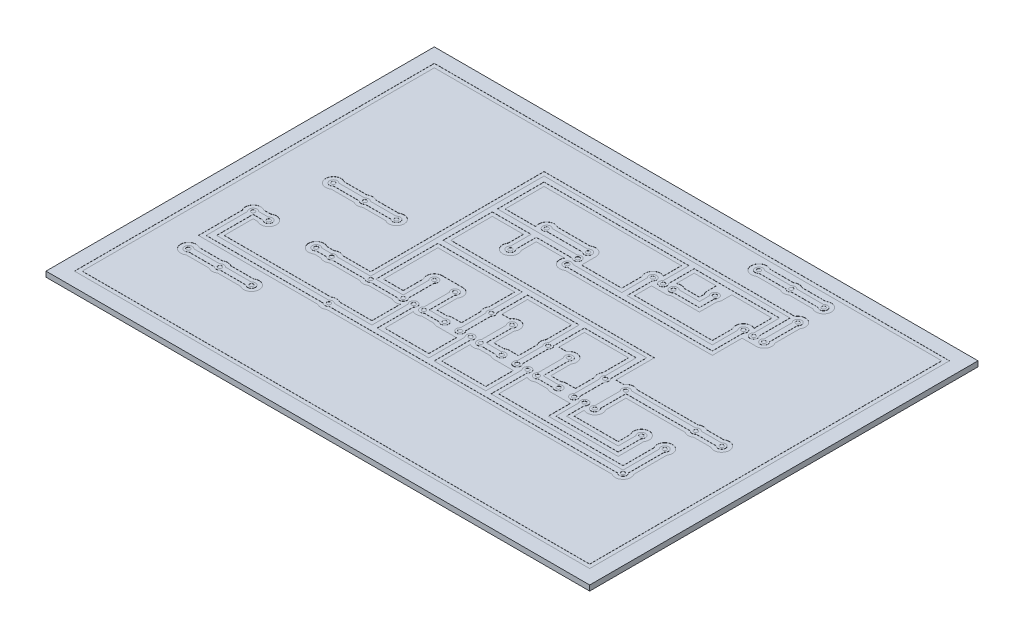
from build123d import *

# Parameters (mm, degrees)
SKETCH1_W           = 210
SKETCH1_H           = 150
BOSS_EXTRUDE3_DEPTH = 2
SKETCH1_5_R         = 0.75
SKETCH1_5_R_2       = 0.750000002
SKETCH1_5_R_3       = 0.750000001
BOSS_EXTRUDE4_DEPTH = 2.05
SKETCH2_W           = 210
SKETCH2_H           = 150
BOSS_EXTRUDE6_DEPTH = 0.05
SKETCH3_W           = 199
SKETCH3_H           = 139
SKETCH3_W_2         = 196
SKETCH3_H_2         = 136
CUT_EXTRUDE1_DEPTH  = 0.05


with BuildPart() as part:
    # Sketch1 → Boss-Extrude3 (new body)
    with BuildSketch(Plane(origin=(0, 0, 0), x_dir=(1, 0, 0), z_dir=(0, 1, 0))):
        Rectangle(SKETCH1_W, SKETCH1_H)
    extrude(amount=BOSS_EXTRUDE3_DEPTH)

    # Sketch1<5> → Boss-Extrude4 (add)
    # profile 1 of 14: a face of its own
    with BuildSketch(Plane(origin=(0, 0, 0), x_dir=(1, 0, 0), z_dir=(0, 1, 0))):
        with BuildLine():
            ThreePointArc((-83.881966011, -14), (-86.060660172, -13.939339828), (-86, -16.118033989))
            Line((-86, -16.118033989), (-86, -32.118033989))
            Line((-86, -32.118033989), (-40.736067977, -32.118033989))
            ThreePointArc((-40.736067977, -32.118033989), (-39.618033989, -32.618033989), (-38.5, -32.118033989))
            Line((-38.5, -32.118033989), (72.881966011, -32.118033989))
            ThreePointArc((72.881966011, -32.118033989), (75.060660172, -32.178694161), (75, -30))
            Line((75, -30), (75, -16.118033989))
            ThreePointArc((75, -16.118033989), (74, -13.5), (73, -16.118033989))
            Line((73, -16.118033989), (73, -30))
            ThreePointArc((73, -30), (72.939339828, -30.057373817), (72.881966011, -30.118033989))
            Line((72.881966011, -30.118033989), (22, -30.118033989))
            Line((22, -30.118033989), (22, -16.118033989))
            ThreePointArc((22, -16.118033989), (21, -13.5), (20, -16.118033989))
            Line((20, -16.118033989), (20, -30.118033989))
            Line((20, -30.118033989), (0, -30.118033989))
            Line((0, -30.118033989), (0, -16.118033989))
            ThreePointArc((0, -16.118033989), (-1, -13.5), (-2, -16.118033989))
            Line((-2, -16.118033989), (-2, -30.118033989))
            Line((-2, -30.118033989), (-22, -30.118033989))
            Line((-22, -30.118033989), (-22, -16.118033989))
            ThreePointArc((-22, -16.118033989), (-23, -13.5), (-24, -16.118033989))
            Line((-24, -16.118033989), (-24, -30.118033989))
            Line((-24, -30.118033989), (-38.5, -30.118033989))
            ThreePointArc((-38.5, -30.118033989), (-39.618033989, -29.618033989), (-40.736067977, -30.118033989))
            Line((-40.736067977, -30.118033989), (-84, -30.118033989))
            Line((-84, -30.118033989), (-84, -16.118033989))
            ThreePointArc((-84, -16.118033989), (-83.939339828, -16.060660172), (-83.881966011, -16))
            Line((-83.881966011, -16), (-80.118033989, -16))
            ThreePointArc((-80.118033989, -16), (-77.5, -15), (-80.118033989, -14))
            Line((-80.118033989, -14), (-83.881966011, -14))
        make_face()
        with Locations((-85, -15)):
            Circle(SKETCH1_5_R, mode=Mode.SUBTRACT)
        with Locations((-79, -15)):
            Circle(SKETCH1_5_R, mode=Mode.SUBTRACT)
        with Locations((-39.618033989, -31.118033989)):
            Circle(SKETCH1_5_R, mode=Mode.SUBTRACT)
        with Locations((-23, -15)):
            Circle(SKETCH1_5_R_2, mode=Mode.SUBTRACT)
        with Locations((-1, -15)):
            Circle(SKETCH1_5_R_3, mode=Mode.SUBTRACT)
        with Locations((21, -15)):
            Circle(SKETCH1_5_R_3, mode=Mode.SUBTRACT)
        with Locations((74, -31.118033989)):
            Circle(SKETCH1_5_R, mode=Mode.SUBTRACT)
        with Locations((74, -15)):
            Circle(SKETCH1_5_R, mode=Mode.SUBTRACT)
    # profile 2 of 14: a face of its own
    with BuildSketch(Plane(origin=(0, 0, 0), x_dir=(1, 0, 0), z_dir=(0, 1, 0))):
        with BuildLine():
            Line((-20, -4.118033989), (-20, -13.881966011))
            ThreePointArc((-20, -13.881966011), (-20.060660172, -16.060660172), (-17.881966011, -16))
            Line((-17.881966011, -16), (-12.118033989, -16))
            ThreePointArc((-12.118033989, -16), (-9.5, -15), (-12.118033989, -14))
            Line((-12.118033989, -14), (-17.881966011, -14))
            ThreePointArc((-17.881966011, -14), (-17.939339828, -13.939339828), (-18, -13.881966011))
            Line((-18, -13.881966011), (-18, -4.118033989))
            ThreePointArc((-18, -4.118033989), (-19, -1.5), (-20, -4.118033989))
        make_face()
        with Locations((-19, -15)):
            Circle(SKETCH1_5_R_2, mode=Mode.SUBTRACT)
        with Locations((-11, -15)):
            Circle(SKETCH1_5_R, mode=Mode.SUBTRACT)
        with Locations((-19, -3)):
            Circle(SKETCH1_5_R, mode=Mode.SUBTRACT)
    # profile 3 of 14: a face of its own
    with BuildSketch(Plane(origin=(0, 0, 0), x_dir=(1, 0, 0), z_dir=(0, 1, 0))):
        with BuildLine():
            Line((-26, -13.881966011), (-26, -4.118033989))
            ThreePointArc((-26, -4.118033989), (-27, -1.5), (-28, -4.118033989))
            Line((-28, -4.118033989), (-28, -13.881966011))
            ThreePointArc((-28, -13.881966011), (-28.060660172, -13.939339828), (-28.118033989, -14))
            Line((-28.118033989, -14), (-38.5, -14))
            ThreePointArc((-38.5, -14), (-38.557373817, -13.939339828), (-38.618033989, -13.881966011))
            Line((-38.618033989, -13.881966011), (-38.618033989, 10))
            Line((-38.618033989, 10), (-6, 10))
            Line((-6, 10), (-6, -1.881966011))
            ThreePointArc((-6, -1.881966011), (-6.5, -3), (-6, -4.118033989))
            Line((-6, -4.118033989), (-6, -13.881966011))
            ThreePointArc((-6, -13.881966011), (-5, -16.5), (-4, -13.881966011))
            Line((-4, -13.881966011), (-4, -4.118033989))
            ThreePointArc((-4, -4.118033989), (-3.5, -3), (-4, -1.881966011))
            Line((-4, -1.881966011), (-4, 10))
            Line((-4, 10), (16, 10))
            Line((16, 10), (16, -1.881966011))
            ThreePointArc((16, -1.881966011), (15.5, -3), (16, -4.118033989))
            Line((16, -4.118033989), (16, -13.881966011))
            ThreePointArc((16, -13.881966011), (17, -16.5), (18, -13.881966011))
            Line((18, -13.881966011), (18, -4.118033989))
            ThreePointArc((18, -4.118033989), (18.5, -3), (18, -1.881966011))
            Line((18, -1.881966011), (18, 10))
            Line((18, 10), (38, 10))
            Line((38, 10), (38, -1.881966011))
            ThreePointArc((38, -1.881966011), (37.5, -3), (38, -4.118033989))
            Line((38, -4.118033989), (38, -13.881966011))
            ThreePointArc((38, -13.881966011), (39, -16.5), (40, -13.881966011))
            Line((40, -13.881966011), (40, -4.118033989))
            ThreePointArc((40, -4.118033989), (40.5, -3), (40, -1.881966011))
            Line((40, -1.881966011), (40, 12))
            Line((40, 12), (-38.618033989, 12))
            Line((-38.618033989, 12), (-38.618033989, 31))
            Line((-38.618033989, 31), (-23.618033989, 31))
            Line((-23.618033989, 31), (-23.618033989, 23.118033989))
            ThreePointArc((-23.618033989, 23.118033989), (-22.618033989, 20.5), (-21.618033989, 23.118033989))
            Line((-21.618033989, 23.118033989), (-21.618033989, 31))
            Line((-21.618033989, 31), (-7.736067977, 31))
            ThreePointArc((-7.736067977, 31), (-5.118033989, 32), (-7.736067977, 33))
            Line((-7.736067977, 33), (-38.618033989, 33))
            Line((-38.618033989, 33), (-38.618033989, 51))
            Line((-38.618033989, 51), (17.381966011, 51))
            Line((17.381966011, 51), (17.381966011, 41.118033989))
            ThreePointArc((17.381966011, 41.118033989), (18.381966011, 38.5), (19.381966011, 41.118033989))
            Line((19.381966011, 41.118033989), (19.381966011, 51))
            Line((19.381966011, 51), (52.381966011, 51))
            Line((52.381966011, 51), (52.381966011, 41.118033989))
            ThreePointArc((52.381966011, 41.118033989), (53.381966011, 38.5), (54.381966011, 41.118033989))
            Line((54.381966011, 41.118033989), (54.381966011, 53))
            Line((54.381966011, 53), (-40.618033989, 53))
            Line((-40.618033989, 53), (-40.618033989, -13.881966011))
            ThreePointArc((-40.618033989, -13.881966011), (-40.678694161, -13.939339828), (-40.736067977, -14))
            Line((-40.736067977, -14), (-53.5, -14))
            ThreePointArc((-53.5, -14), (-54.618033989, -13.5), (-55.736067977, -14))
            Line((-55.736067977, -14), (-59.5, -14))
            ThreePointArc((-59.5, -14), (-62.118033989, -15), (-59.5, -16))
            Line((-59.5, -16), (-55.736067977, -16))
            ThreePointArc((-55.736067977, -16), (-54.618033989, -16.5), (-53.5, -16))
            Line((-53.5, -16), (-40.736067977, -16))
            ThreePointArc((-40.736067977, -16), (-39.618033989, -16.5), (-38.5, -16))
            Line((-38.5, -16), (-28.118033989, -16))
            ThreePointArc((-28.118033989, -16), (-25.939339828, -16.060660172), (-26, -13.881966011))
        make_face()
        with Locations((-60.618033989, -15)):
            Circle(SKETCH1_5_R, mode=Mode.SUBTRACT)
        with Locations((-54.618033989, -15)):
            Circle(SKETCH1_5_R, mode=Mode.SUBTRACT)
        with Locations((-39.618033989, -15)):
            Circle(SKETCH1_5_R, mode=Mode.SUBTRACT)
        with Locations((-27, -15)):
            Circle(SKETCH1_5_R_2, mode=Mode.SUBTRACT)
        with Locations((-27, -3)):
            Circle(SKETCH1_5_R, mode=Mode.SUBTRACT)
        with Locations((-5, -15)):
            Circle(SKETCH1_5_R_2, mode=Mode.SUBTRACT)
        with Locations((-5, -3)):
            Circle(SKETCH1_5_R, mode=Mode.SUBTRACT)
        with Locations((17, -15)):
            Circle(SKETCH1_5_R_2, mode=Mode.SUBTRACT)
        with Locations((17, -3)):
            Circle(SKETCH1_5_R, mode=Mode.SUBTRACT)
        with Locations((39, -15)):
            Circle(SKETCH1_5_R_2, mode=Mode.SUBTRACT)
        with Locations((39, -3)):
            Circle(SKETCH1_5_R, mode=Mode.SUBTRACT)
        with Locations((-22.618033989, 22)):
            Circle(SKETCH1_5_R, mode=Mode.SUBTRACT)
        with Locations((-6.618033989, 32)):
            Circle(SKETCH1_5_R_2, mode=Mode.SUBTRACT)
        with Locations((18.381966011, 40)):
            Circle(SKETCH1_5_R_2, mode=Mode.SUBTRACT)
        with Locations((53.381966011, 40)):
            Circle(SKETCH1_5_R, mode=Mode.SUBTRACT)
    # profile 4 of 14: a face of its own
    with BuildSketch(Plane(origin=(0, 0, 0), x_dir=(1, 0, 0), z_dir=(0, 1, 0))):
        with BuildLine():
            Line((4, -13.881966011), (4, -4.118033989))
            ThreePointArc((4, -4.118033989), (3, -1.5), (2, -4.118033989))
            Line((2, -4.118033989), (2, -13.881966011))
            ThreePointArc((2, -13.881966011), (1.939339828, -16.060660172), (4.118033989, -16))
            Line((4.118033989, -16), (9.881966011, -16))
            ThreePointArc((9.881966011, -16), (12.5, -15), (9.881966011, -14))
            Line((9.881966011, -14), (4.118033989, -14))
            ThreePointArc((4.118033989, -14), (4.060660172, -13.939339828), (4, -13.881966011))
        make_face()
        with Locations((3, -15)):
            Circle(SKETCH1_5_R_2, mode=Mode.SUBTRACT)
        with Locations((11, -15)):
            Circle(SKETCH1_5_R, mode=Mode.SUBTRACT)
        with Locations((3, -3)):
            Circle(SKETCH1_5_R, mode=Mode.SUBTRACT)
    # profile 5 of 14: a face of its own
    with BuildSketch(Plane(origin=(0, 0, 0), x_dir=(1, 0, 0), z_dir=(0, 1, 0))):
        with BuildLine():
            Line((24, -4.118033989), (24, -13.881966011))
            ThreePointArc((24, -13.881966011), (23.939339828, -16.060660172), (26.118033989, -16))
            Line((26.118033989, -16), (31.881966011, -16))
            ThreePointArc((31.881966011, -16), (34.5, -15), (31.881966011, -14))
            Line((31.881966011, -14), (26.118033989, -14))
            ThreePointArc((26.118033989, -14), (26.060660172, -13.939339828), (26, -13.881966011))
            Line((26, -13.881966011), (26, -4.118033989))
            ThreePointArc((26, -4.118033989), (25, -1.5), (24, -4.118033989))
        make_face()
        with Locations((25, -15)):
            Circle(SKETCH1_5_R_2, mode=Mode.SUBTRACT)
        with Locations((25, -3)):
            Circle(SKETCH1_5_R, mode=Mode.SUBTRACT)
        with Locations((33, -15)):
            Circle(SKETCH1_5_R, mode=Mode.SUBTRACT)
    # profile 6 of 14: a face of its own
    with BuildSketch(Plane(origin=(0, 0, 0), x_dir=(1, 0, 0), z_dir=(0, 1, 0))):
        with BuildLine():
            Line((48, -13.881966011), (48, -4.118033989))
            ThreePointArc((48, -4.118033989), (48.060660172, -4.060660172), (48.118033989, -4))
            Line((48.118033989, -4), (72.881966011, -4))
            ThreePointArc((72.881966011, -4), (74, -4.5), (75.118033989, -4))
            Line((75.118033989, -4), (82.881966011, -4))
            ThreePointArc((82.881966011, -4), (85.5, -3), (82.881966011, -2))
            Line((82.881966011, -2), (75.118033989, -2))
            ThreePointArc((75.118033989, -2), (74, -1.5), (72.881966011, -2))
            Line((72.881966011, -2), (48.118033989, -2))
            ThreePointArc((48.118033989, -2), (45.939339828, -1.939339828), (46, -4.118033989))
            Line((46, -4.118033989), (46, -13.881966011))
            ThreePointArc((46, -13.881966011), (47, -16.5), (48, -13.881966011))
        make_face()
        with Locations((47, -15)):
            Circle(SKETCH1_5_R, mode=Mode.SUBTRACT)
        with Locations((47, -3)):
            Circle(SKETCH1_5_R, mode=Mode.SUBTRACT)
        with Locations((74, -3)):
            Circle(SKETCH1_5_R, mode=Mode.SUBTRACT)
        with Locations((84, -3)):
            Circle(SKETCH1_5_R, mode=Mode.SUBTRACT)
    # profile 7 of 14: a face of its own
    with BuildSketch(Plane(origin=(0, 0, 0), x_dir=(1, 0, 0), z_dir=(0, 1, 0))):
        with BuildLine():
            Line((44, -23), (44, -16.118033989))
            ThreePointArc((44, -16.118033989), (43, -13.5), (42, -16.118033989))
            Line((42, -16.118033989), (42, -25))
            Line((42, -25), (66, -25))
            Line((66, -25), (66, -16.118033989))
            ThreePointArc((66, -16.118033989), (65, -13.5), (64, -16.118033989))
            Line((64, -16.118033989), (64, -23))
            Line((64, -23), (44, -23))
        make_face()
        with Locations((43, -15)):
            Circle(SKETCH1_5_R, mode=Mode.SUBTRACT)
        with Locations((65, -15)):
            Circle(SKETCH1_5_R, mode=Mode.SUBTRACT)
    # profile 8 of 14: a face of its own
    with BuildSketch(Plane(origin=(0, 0, 0), x_dir=(1, 0, 0), z_dir=(0, 1, 0))):
        with BuildLine():
            Line((13.381966011, 29), (-5.5, 29))
            ThreePointArc((-5.5, 29), (-8.118033989, 28), (-5.5, 27))
            Line((-5.5, 27), (50.381966011, 27))
            Line((50.381966011, 27), (50.381966011, 38.881966011))
            ThreePointArc((50.381966011, 38.881966011), (49.381966011, 41.5), (48.381966011, 38.881966011))
            Line((48.381966011, 38.881966011), (48.381966011, 29))
            Line((48.381966011, 29), (15.381966011, 29))
            Line((15.381966011, 29), (15.381966011, 38.881966011))
            ThreePointArc((15.381966011, 38.881966011), (14.381966011, 41.5), (13.381966011, 38.881966011))
            Line((13.381966011, 38.881966011), (13.381966011, 29))
        make_face()
        with Locations((-6.618033989, 28)):
            Circle(SKETCH1_5_R_2, mode=Mode.SUBTRACT)
        with Locations((14.381966011, 40)):
            Circle(SKETCH1_5_R_2, mode=Mode.SUBTRACT)
        with Locations((49.381966011, 40)):
            Circle(SKETCH1_5_R, mode=Mode.SUBTRACT)
    # profile 9 of 14: a face of its own
    with BuildSketch(Plane(origin=(0, 0, 0), x_dir=(1, 0, 0), z_dir=(0, 1, 0))):
        with BuildLine():
            Line((46, 62), (56.263932023, 62))
            ThreePointArc((56.263932023, 62), (58.881966011, 63), (56.263932023, 64))
            Line((56.263932023, 64), (46, 64))
            ThreePointArc((46, 64), (44.881966011, 64.5), (43.763932023, 64))
            Line((43.763932023, 64), (33.5, 64))
            ThreePointArc((33.5, 64), (30.881966011, 63), (33.5, 62))
            Line((33.5, 62), (43.763932023, 62))
            ThreePointArc((43.763932023, 62), (44.881966011, 61.5), (46, 62))
        make_face()
        with Locations((32.381966011, 63)):
            Circle(SKETCH1_5_R, mode=Mode.SUBTRACT)
        with Locations((44.881966011, 63)):
            Circle(SKETCH1_5_R, mode=Mode.SUBTRACT)
        with Locations((57.381966011, 63)):
            Circle(SKETCH1_5_R, mode=Mode.SUBTRACT)
    # profile 10 of 14: a face of its own
    with BuildSketch(Plane(origin=(0, 0, 0), x_dir=(1, 0, 0), z_dir=(0, 1, 0))):
        with BuildLine():
            ThreePointArc((23.5, 41), (20.881966011, 40), (23.5, 39))
            Line((23.5, 39), (33.381966011, 39))
            Line((33.381966011, 39), (33.381966011, 44.881966011))
            ThreePointArc((33.381966011, 44.881966011), (32.381966011, 47.5), (31.381966011, 44.881966011))
            Line((31.381966011, 44.881966011), (31.381966011, 41))
            Line((31.381966011, 41), (23.5, 41))
        make_face()
        with Locations((22.381966011, 40)):
            Circle(SKETCH1_5_R_2, mode=Mode.SUBTRACT)
        with Locations((32.381966011, 46)):
            Circle(SKETCH1_5_R, mode=Mode.SUBTRACT)
    # profile 11 of 14: a face of its own
    with BuildSketch(Plane(origin=(0, 0, 0), x_dir=(1, 0, 0), z_dir=(0, 1, 0))):
        with BuildLine():
            ThreePointArc((-7.736067977, 35), (-5.118033989, 36), (-7.736067977, 37))
            Line((-7.736067977, 37), (-21.5, 37))
            ThreePointArc((-21.5, 37), (-24.118033989, 36), (-21.5, 35))
            Line((-21.5, 35), (-7.736067977, 35))
        make_face()
        with Locations((-22.618033989, 36)):
            Circle(SKETCH1_5_R_2, mode=Mode.SUBTRACT)
        with Locations((-6.618033989, 36)):
            Circle(SKETCH1_5_R_2, mode=Mode.SUBTRACT)
    # profile 12 of 14: a face of its own
    with BuildSketch(Plane(origin=(0, 0, 0), x_dir=(1, 0, 0), z_dir=(0, 1, 0))):
        with BuildLine():
            ThreePointArc((56.381966011, 41.118033989), (57.381966011, 38.5), (58.381966011, 41.118033989))
            Line((58.381966011, 41.118033989), (58.381966011, 51.881966011))
            ThreePointArc((58.381966011, 51.881966011), (57.381966011, 54.5), (56.381966011, 51.881966011))
            Line((56.381966011, 51.881966011), (56.381966011, 41.118033989))
        make_face()
        with Locations((57.381966011, 40)):
            Circle(SKETCH1_5_R, mode=Mode.SUBTRACT)
        with Locations((57.381966011, 53)):
            Circle(SKETCH1_5_R, mode=Mode.SUBTRACT)
    # profile 13 of 14: a face of its own
    with BuildSketch(Plane(origin=(0, 0, 0), x_dir=(1, 0, 0), z_dir=(0, 1, 0))):
        with BuildLine():
            Line((-65.690983006, 9), (-55.736067977, 9))
            ThreePointArc((-55.736067977, 9), (-53.118033989, 10), (-55.736067977, 11))
            Line((-55.736067977, 11), (-65.690983006, 11))
            ThreePointArc((-65.690983006, 11), (-66.809016994, 11.5), (-67.927050983, 11))
            Line((-67.927050983, 11), (-77.881966011, 11))
            ThreePointArc((-77.881966011, 11), (-80.5, 10), (-77.881966011, 9))
            Line((-77.881966011, 9), (-67.927050983, 9))
            ThreePointArc((-67.927050983, 9), (-66.809016994, 8.5), (-65.690983006, 9))
        make_face()
        with Locations((-79, 10)):
            Circle(SKETCH1_5_R, mode=Mode.SUBTRACT)
        with Locations((-66.809016994, 10)):
            Circle(SKETCH1_5_R, mode=Mode.SUBTRACT)
        with Locations((-54.618033989, 10)):
            Circle(SKETCH1_5_R, mode=Mode.SUBTRACT)
    # profile 14 of 14: a face of its own
    with BuildSketch(Plane(origin=(0, 0, 0), x_dir=(1, 0, 0), z_dir=(0, 1, 0))):
        with BuildLine():
            Line((-71.690983006, -41), (-61.736067978, -41))
            ThreePointArc((-61.736067978, -41), (-59.118033989, -40), (-61.736067978, -39))
            Line((-61.736067978, -39), (-71.690983006, -39))
            ThreePointArc((-71.690983006, -39), (-72.809016994, -38.5), (-73.927050983, -39))
            Line((-73.927050983, -39), (-83.881966011, -39))
            ThreePointArc((-83.881966011, -39), (-86.5, -40), (-83.881966011, -41))
            Line((-83.881966011, -41), (-73.927050983, -41))
            ThreePointArc((-73.927050983, -41), (-72.809016994, -41.5), (-71.690983006, -41))
        make_face()
        with Locations((-85, -40)):
            Circle(SKETCH1_5_R, mode=Mode.SUBTRACT)
        with Locations((-72.809016994, -40)):
            Circle(SKETCH1_5_R, mode=Mode.SUBTRACT)
        with Locations((-60.618033989, -40)):
            Circle(SKETCH1_5_R, mode=Mode.SUBTRACT)
    extrude(amount=BOSS_EXTRUDE4_DEPTH)

    # Sketch2 → Boss-Extrude6 (add)
    # profile 1 of 9: a face of its own
    with BuildSketch(Plane(origin=(0, 2, 0), x_dir=(1, 0, 0), z_dir=(0, 1, 0))):
        Rectangle(SKETCH2_W, SKETCH2_H)
        with BuildLine():
            Line((-74.46732939, -42.5), (-83.341687605, -42.5))
            ThreePointArc((-83.341687605, -42.5), (-88, -40), (-83.341687605, -37.5))
            Line((-83.341687605, -37.5), (-74.46732939, -37.5))
            ThreePointArc((-74.46732939, -37.5), (-72.809016994, -37), (-71.150704599, -37.5))
            Line((-71.150704599, -37.5), (-62.276346384, -37.5))
            ThreePointArc((-62.276346384, -37.5), (-57.618033989, -40), (-62.276346384, -42.5))
            Line((-62.276346384, -42.5), (-71.150704599, -42.5))
            ThreePointArc((-71.150704599, -42.5), (-72.809016994, -43), (-74.46732939, -42.5))
        make_face(mode=Mode.SUBTRACT)
        with BuildLine():
            Line((-68.46732939, 7.5), (-77.341687605, 7.5))
            ThreePointArc((-77.341687605, 7.5), (-82, 10), (-77.341687605, 12.5))
            Line((-77.341687605, 12.5), (-68.46732939, 12.5))
            ThreePointArc((-68.46732939, 12.5), (-66.809016994, 13), (-65.150704599, 12.5))
            Line((-65.150704599, 12.5), (-56.276346384, 12.5))
            ThreePointArc((-56.276346384, 12.5), (-51.618033989, 10), (-56.276346384, 7.5))
            Line((-56.276346384, 7.5), (-65.150704599, 7.5))
            ThreePointArc((-65.150704599, 7.5), (-66.809016994, 7), (-68.46732939, 7.5))
        make_face(mode=Mode.SUBTRACT)
        with BuildLine():
            Line((41.5, 13.5), (41.5, -1.341687605))
            Line((41.5, -1.341687605), (44.5, -1.341687605))
            ThreePointArc((44.5, -1.341687605), (46.404836987, -0.059629107), (48.658312395, -0.5))
            Line((48.658312395, -0.5), (72.341687605, -0.5))
            ThreePointArc((72.341687605, -0.5), (74, 0), (75.658312395, -0.5))
            Line((75.658312395, -0.5), (82.341687605, -0.5))
            ThreePointArc((82.341687605, -0.5), (87, -3), (82.341687605, -5.5))
            Line((82.341687605, -5.5), (75.658312395, -5.5))
            ThreePointArc((75.658312395, -5.5), (74, -6), (72.341687605, -5.5))
            Line((72.341687605, -5.5), (49.5, -5.5))
            Line((49.5, -5.5), (49.5, -13.341687605))
            ThreePointArc((49.5, -13.341687605), (49.186140662, -17.054455891), (45.5, -17.598076211))
            Line((45.5, -17.598076211), (45.5, -21.5))
            Line((45.5, -21.5), (62.5, -21.5))
            Line((62.5, -21.5), (62.5, -16.658312395))
            ThreePointArc((62.5, -16.658312395), (65, -12), (67.5, -16.658312395))
            Line((67.5, -16.658312395), (67.5, -26.5))
            Line((67.5, -26.5), (40.5, -26.5))
            Line((40.5, -26.5), (40.5, -18))
            Line((40.5, -18), (33, -18))
            ThreePointArc((33, -18), (32.133974596, -17.872281323), (31.341687605, -17.5))
            Line((31.341687605, -17.5), (26.658312395, -17.5))
            ThreePointArc((26.658312395, -17.5), (25.093115194, -17.998554579), (23.5, -17.598076211))
            Line((23.5, -17.598076211), (23.5, -28.618033989))
            Line((23.5, -28.618033989), (71.5, -28.618033989))
            Line((71.5, -28.618033989), (71.5, -16.658312395))
            ThreePointArc((71.5, -16.658312395), (74, -12), (76.5, -16.658312395))
            Line((76.5, -16.658312395), (76.5, -29.459721594))
            ThreePointArc((76.5, -29.459721594), (76.121320344, -33.239354332), (72.341687605, -33.618033989))
            Line((72.341687605, -33.618033989), (-37.959721594, -33.618033989))
            ThreePointArc((-37.959721594, -33.618033989), (-39.618033989, -34.118033989), (-41.276346384, -33.618033989))
            Line((-41.276346384, -33.618033989), (-87.5, -33.618033989))
            Line((-87.5, -33.618033989), (-87.5, -16.658312395))
            ThreePointArc((-87.5, -16.658312395), (-87.121320344, -12.878679656), (-83.341687605, -12.5))
            Line((-83.341687605, -12.5), (-80.658312395, -12.5))
            ThreePointArc((-80.658312395, -12.5), (-76, -15), (-80.658312395, -17.5))
            Line((-80.658312395, -17.5), (-82.5, -17.5))
            Line((-82.5, -17.5), (-82.5, -28.618033989))
            Line((-82.5, -28.618033989), (-41.276346384, -28.618033989))
            ThreePointArc((-41.276346384, -28.618033989), (-39.618033989, -28.118033989), (-37.959721594, -28.618033989))
            Line((-37.959721594, -28.618033989), (-25.5, -28.618033989))
            Line((-25.5, -28.618033989), (-25.5, -17.598076211))
            ThreePointArc((-25.5, -17.598076211), (-27.093115194, -17.998554579), (-28.658312395, -17.5))
            Line((-28.658312395, -17.5), (-37.959721594, -17.5))
            ThreePointArc((-37.959721594, -17.5), (-39.618033989, -18), (-41.276346384, -17.5))
            Line((-41.276346384, -17.5), (-52.959721594, -17.5))
            ThreePointArc((-52.959721594, -17.5), (-54.618033989, -18), (-56.276346384, -17.5))
            Line((-56.276346384, -17.5), (-58.959721594, -17.5))
            ThreePointArc((-58.959721594, -17.5), (-63.618033989, -15), (-58.959721594, -12.5))
            Line((-58.959721594, -12.5), (-56.276346384, -12.5))
            ThreePointArc((-56.276346384, -12.5), (-54.618033989, -12), (-52.959721594, -12.5))
            Line((-52.959721594, -12.5), (-42.118033989, -12.5))
            Line((-42.118033989, -12.5), (-42.118033989, 54.5))
            Line((-42.118033989, 54.5), (54.7838898, 54.5))
            ThreePointArc((54.7838898, 54.5), (58.961883424, 55.550266842), (59.881966011, 51.341687605))
            Line((59.881966011, 51.341687605), (59.881966011, 41.658312395))
            ThreePointArc((59.881966011, 41.658312395), (60.025348048, 38.581362835), (57.381966011, 37))
            Line((57.381966011, 37), (51.881966011, 37))
            Line((51.881966011, 37), (51.881966011, 25.5))
            Line((51.881966011, 25.5), (-4.959721594, 25.5))
            ThreePointArc((-4.959721594, 25.5), (-8.67248988, 25.813859338), (-9.2161102, 29.5))
            Line((-9.2161102, 29.5), (-20.118033989, 29.5))
            Line((-20.118033989, 29.5), (-20.118033989, 23.658312395))
            ThreePointArc((-20.118033989, 23.658312395), (-22.618033989, 19), (-25.118033989, 23.658312395))
            Line((-25.118033989, 23.658312395), (-25.118033989, 29.5))
            Line((-25.118033989, 29.5), (-37.118033989, 29.5))
            Line((-37.118033989, 29.5), (-37.118033989, 13.5))
            Line((-37.118033989, 13.5), (41.5, 13.5))
        make_face(mode=Mode.SUBTRACT)
        with BuildLine():
            Line((43.223653616, 60.5), (34.040278406, 60.5))
            ThreePointArc((34.040278406, 60.5), (29.381966011, 63), (34.040278406, 65.5))
            Line((34.040278406, 65.5), (43.223653616, 65.5))
            ThreePointArc((43.223653616, 65.5), (44.881966011, 66), (46.540278406, 65.5))
            Line((46.540278406, 65.5), (55.723653616, 65.5))
            ThreePointArc((55.723653616, 65.5), (60.381966011, 63), (55.723653616, 60.5))
            Line((55.723653616, 60.5), (46.540278406, 60.5))
            ThreePointArc((46.540278406, 60.5), (44.881966011, 60), (43.223653616, 60.5))
        make_face(mode=Mode.SUBTRACT)
    # profile 2 of 9: a face of its own
    with BuildSketch(Plane(origin=(0, 2, 0), x_dir=(1, 0, 0), z_dir=(0, 1, 0))):
        with BuildLine():
            ThreePointArc((-12.658312395, -12.5), (-11.866025404, -12.127718677), (-11, -12))
            Line((-11, -12), (-7.5, -12))
            Line((-7.5, -12), (-7.5, -4.658312395))
            ThreePointArc((-7.5, -4.658312395), (-8, -3), (-7.5, -1.341687605))
            Line((-7.5, -1.341687605), (-7.5, 8.5))
            Line((-7.5, 8.5), (-37.118033989, 8.5))
            Line((-37.118033989, 8.5), (-37.118033989, -12.5))
            Line((-37.118033989, -12.5), (-29.5, -12.5))
            Line((-29.5, -12.5), (-29.5, -4.658312395))
            ThreePointArc((-29.5, -4.658312395), (-29.643382037, -1.581362835), (-27, 0))
            Line((-27, 0), (-19, 0))
            ThreePointArc((-19, 0), (-16.356617963, -1.581362835), (-16.5, -4.658312395))
            Line((-16.5, -4.658312395), (-16.5, -12.5))
            Line((-16.5, -12.5), (-12.658312395, -12.5))
        make_face()
    # profile 3 of 9: a face of its own
    with BuildSketch(Plane(origin=(0, 2, 0), x_dir=(1, 0, 0), z_dir=(0, 1, 0))):
        with BuildLine():
            Line((-3.5, -28.618033989), (-3.5, -18))
            Line((-3.5, -18), (-11, -18))
            ThreePointArc((-11, -18), (-11.866025404, -17.872281323), (-12.658312395, -17.5))
            Line((-12.658312395, -17.5), (-17.341687605, -17.5))
            ThreePointArc((-17.341687605, -17.5), (-18.906884806, -17.998554579), (-20.5, -17.598076211))
            Line((-20.5, -17.598076211), (-20.5, -28.618033989))
            Line((-20.5, -28.618033989), (-3.5, -28.618033989))
        make_face()
    # profile 4 of 9: a face of its own
    with BuildSketch(Plane(origin=(0, 2, 0), x_dir=(1, 0, 0), z_dir=(0, 1, 0))):
        with BuildLine():
            ThreePointArc((9.341687605, -12.5), (10.133974596, -12.127718677), (11, -12))
            Line((11, -12), (14.5, -12))
            Line((14.5, -12), (14.5, -4.658312395))
            ThreePointArc((14.5, -4.658312395), (14, -3), (14.5, -1.341687605))
            Line((14.5, -1.341687605), (14.5, 8.5))
            Line((14.5, 8.5), (-2.5, 8.5))
            Line((-2.5, 8.5), (-2.5, -1.341687605))
            Line((-2.5, -1.341687605), (0.5, -1.341687605))
            ThreePointArc((0.5, -1.341687605), (4.658312395, -0.5), (5.5, -4.658312395))
            Line((5.5, -4.658312395), (5.5, -12.5))
            Line((5.5, -12.5), (9.341687605, -12.5))
        make_face()
    # profile 5 of 9: a face of its own
    with BuildSketch(Plane(origin=(0, 2, 0), x_dir=(1, 0, 0), z_dir=(0, 1, 0))):
        with BuildLine():
            Line((29.381966011, 46), (29.381966011, 49.5))
            Line((29.381966011, 49.5), (20.881966011, 49.5))
            Line((20.881966011, 49.5), (20.881966011, 42.598076211))
            ThreePointArc((20.881966011, 42.598076211), (22.475081206, 42.998554579), (24.040278406, 42.5))
            Line((24.040278406, 42.5), (29.881966011, 42.5))
            Line((29.881966011, 42.5), (29.881966011, 44.341687605))
            ThreePointArc((29.881966011, 44.341687605), (29.509684688, 45.133974596), (29.381966011, 46))
        make_face()
    # profile 6 of 9: a face of its own
    with BuildSketch(Plane(origin=(0, 2, 0), x_dir=(1, 0, 0), z_dir=(0, 1, 0))):
        with BuildLine():
            Line((18.5, -28.618033989), (18.5, -18))
            Line((18.5, -18), (11, -18))
            ThreePointArc((11, -18), (10.133974596, -17.872281323), (9.341687605, -17.5))
            Line((9.341687605, -17.5), (4.658312395, -17.5))
            ThreePointArc((4.658312395, -17.5), (3.093115194, -17.998554579), (1.5, -17.598076211))
            Line((1.5, -17.598076211), (1.5, -28.618033989))
            Line((1.5, -28.618033989), (18.5, -28.618033989))
        make_face()
    # profile 7 of 9: a face of its own
    with BuildSketch(Plane(origin=(0, 2, 0), x_dir=(1, 0, 0), z_dir=(0, 1, 0))):
        with BuildLine():
            ThreePointArc((46.881966011, 38.341687605), (47.19582535, 42.054455891), (50.881966011, 42.598076211))
            Line((50.881966011, 42.598076211), (50.881966011, 49.5))
            Line((50.881966011, 49.5), (35.381966011, 49.5))
            Line((35.381966011, 49.5), (35.381966011, 46))
            ThreePointArc((35.381966011, 46), (35.254247335, 45.133974596), (34.881966011, 44.341687605))
            Line((34.881966011, 44.341687605), (34.881966011, 37.5))
            Line((34.881966011, 37.5), (24.040278406, 37.5))
            ThreePointArc((24.040278406, 37.5), (23.247991415, 37.127718677), (22.381966011, 37))
            Line((22.381966011, 37), (16.881966011, 37))
            Line((16.881966011, 37), (16.881966011, 30.5))
            Line((16.881966011, 30.5), (46.881966011, 30.5))
            Line((46.881966011, 30.5), (46.881966011, 38.341687605))
        make_face()
    # profile 8 of 9: a face of its own
    with BuildSketch(Plane(origin=(0, 2, 0), x_dir=(1, 0, 0), z_dir=(0, 1, 0))):
        with BuildLine():
            Line((-3.618033989, 36), (-3.618033989, 30.5))
            Line((-3.618033989, 30.5), (11.881966011, 30.5))
            Line((11.881966011, 30.5), (11.881966011, 38.341687605))
            ThreePointArc((11.881966011, 38.341687605), (12.19582535, 42.054455891), (15.881966011, 42.598076211))
            Line((15.881966011, 42.598076211), (15.881966011, 49.5))
            Line((15.881966011, 49.5), (-37.118033989, 49.5))
            Line((-37.118033989, 49.5), (-37.118033989, 34.5))
            Line((-37.118033989, 34.5), (-25.2161102, 34.5))
            ThreePointArc((-25.2161102, 34.5), (-24.67248988, 38.186140662), (-20.959721594, 38.5))
            Line((-20.959721594, 38.5), (-8.276346384, 38.5))
            ThreePointArc((-8.276346384, 38.5), (-5.199396823, 38.643382037), (-3.618033989, 36))
        make_face()
    # profile 9 of 9: a face of its own
    with BuildSketch(Plane(origin=(0, 2, 0), x_dir=(1, 0, 0), z_dir=(0, 1, 0))):
        with BuildLine():
            ThreePointArc((31.341687605, -12.5), (32.133974596, -12.127718677), (33, -12))
            Line((33, -12), (36.5, -12))
            Line((36.5, -12), (36.5, -4.658312395))
            ThreePointArc((36.5, -4.658312395), (36, -3), (36.5, -1.341687605))
            Line((36.5, -1.341687605), (36.5, 8.5))
            Line((36.5, 8.5), (19.5, 8.5))
            Line((19.5, 8.5), (19.5, -1.341687605))
            Line((19.5, -1.341687605), (22.5, -1.341687605))
            ThreePointArc((22.5, -1.341687605), (26.658312395, -0.5), (27.5, -4.658312395))
            Line((27.5, -4.658312395), (27.5, -12.5))
            Line((27.5, -12.5), (31.341687605, -12.5))
        make_face()
    extrude(amount=BOSS_EXTRUDE6_DEPTH)

    # Sketch3 → Cut-Extrude1 (cut)
    with BuildSketch(Plane(origin=(0, 2.05, 0), x_dir=(1, 0, 0), z_dir=(0, 1, 0))):
        Rectangle(SKETCH3_W, SKETCH3_H)
        Rectangle(SKETCH3_W_2, SKETCH3_H_2, mode=Mode.SUBTRACT)
    extrude(amount=-CUT_EXTRUDE1_DEPTH, mode=Mode.SUBTRACT)


solid = part.part
